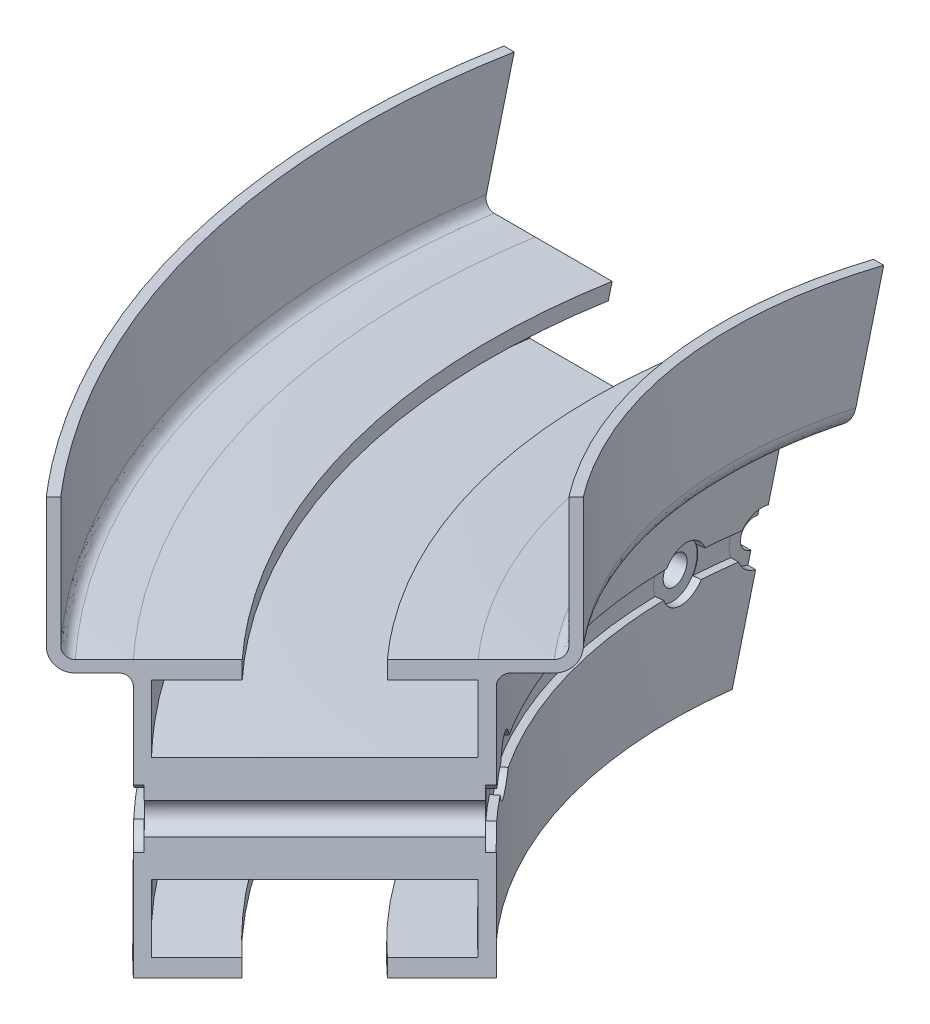
from build123d import *

# Parameters (mm, degrees)
SWEEP1_PITCH                                         = 120
SWEEP1_HEIGHT                                        = 15
SWEEP1_RADIUS                                        = 75
SWEEP1_START_ANGLE                                   = -90
FORO_LAMATO_PER_BULLONE_M5_A_TESTA_ESAGO_D           = 5.4
FORO_LAMATO_PER_BULLONE_M5_A_TESTA_ESAGO_DEPTH       = 60
FORO_LAMATO_PER_BULLONE_M5_A_TESTA_ESAGO_CBORE_D     = 10
FORO_LAMATO_PER_BULLONE_M5_A_TESTA_ESAGO_CBORE_DEPTH = 1.5
FORO_LAMATO_PER_BULLONE_M5_A_TESTA_ESAGO_TIP         = 1.622323671
FORO_LAMATO_PER_BULLONE_M5_A_TESTA_E_2_D             = 5.4
FORO_LAMATO_PER_BULLONE_M5_A_TESTA_E_2_DEPTH         = 60
FORO_LAMATO_PER_BULLONE_M5_A_TESTA_E_2_CBORE_D       = 10
FORO_LAMATO_PER_BULLONE_M5_A_TESTA_E_2_CBORE_DEPTH   = 1.5
FORO_LAMATO_PER_BULLONE_M5_A_TESTA_E_2_TIP           = 1.622323671
TAGLIA_SWEEP1_PITCH                                  = 120
TAGLIA_SWEEP1_HEIGHT                                 = 15
TAGLIA_SWEEP1_RADIUS                                 = 75
TAGLIA_SWEEP1_START_ANGLE                            = -90
SCHIZZO6_W                                           = 1.549169198
SCHIZZO6_H                                           = 5


with BuildPart() as part:
    # Sweep1: sweep along a helix
    with BuildLine() as sweep1_path:
        add(Helix(SWEEP1_PITCH, SWEEP1_HEIGHT, SWEEP1_RADIUS, center=(0, 0, 0), direction=(0, 1, 0), mode=Mode.PRIVATE).rotate(Axis((0, 0, 0), (0, 1, 0)), SWEEP1_START_ANGLE))
    # Schizzo2 → Sweep1 (sweep)
    with BuildSketch(Plane(origin=(-75, 0, 0), x_dir=(1, 0, 0), z_dir=(1.0975449818625416e-14, 0.24677252372232875, 0.9690734345423534))):
        with BuildLine():
            Line((-65, -23.5), (-50, -23.5))
            Line((-50, -23.5), (-50, 19.5))
            ThreePointArc((-50, 19.5), (-49.414213562, 20.914213562), (-48, 21.5))
            Line((-48, 21.5), (-42, 21.5))
            ThreePointArc((-42, 21.5), (-39.171572875, 22.671572875), (-38, 25.5))
            Line((-38, 25.5), (-38, 47.5))
            Line((-38, 47.5), (-40, 47.5))
            Line((-40, 47.5), (-40, 25.5))
            ThreePointArc((-40, 25.5), (-40.585786438, 24.085786438), (-42, 23.5))
            Line((-42, 23.5), (-52.5, 23.5))
            Line((-52.5, 23.5), (-65, 23.5))
            Line((-65, 23.5), (-65, 20.5))
            Line((-65, 20.5), (-52.5, 20.5))
            Line((-52.5, 20.5), (-52.5, 9))
            Line((-52.5, 9), (-97.5, 9))
            Line((-97.5, 9), (-97.5, 20.5))
            Line((-97.5, 20.5), (-85, 20.5))
            Line((-85, 20.5), (-85, 23.5))
            Line((-85, 23.5), (-100, 23.5))
            Line((-100, 23.5), (-108, 23.5))
            ThreePointArc((-108, 23.5), (-109.414213562, 24.085786438), (-110, 25.5))
            Line((-110, 25.5), (-110, 47.5))
            Line((-110, 47.5), (-112, 47.5))
            Line((-112, 47.5), (-112, 25.5))
            ThreePointArc((-112, 25.5), (-110.828427125, 22.671572875), (-108, 21.5))
            Line((-108, 21.5), (-102, 21.5))
            ThreePointArc((-102, 21.5), (-100.585786438, 20.914213562), (-100, 19.5))
            Line((-100, 19.5), (-100, -23.5))
            Line((-100, -23.5), (-85, -23.5))
            Line((-85, -23.5), (-85, -20.5))
            Line((-85, -20.5), (-97.5, -20.5))
            Line((-97.5, -20.5), (-97.5, -9))
            Line((-97.5, -9), (-52.5, -9))
            Line((-52.5, -9), (-52.5, -20.5))
            Line((-52.5, -20.5), (-65, -20.5))
            Line((-65, -20.5), (-65, -23.5))
        make_face()
    sweep(path=sweep1_path.line, is_frenet=True)

    # Foro lamato per Bullone M5 a testa esagonale-1
    with Locations(Plane(origin=(-99.169167537, 12.500016005, 76.095178626), x_dir=(0.608761383675, 0, 0.793353375077), z_dir=(0.793353375077, -3.73878e-07, -0.608761383675))):
        with Locations((0, 0)):
            CounterBoreHole(FORO_LAMATO_PER_BULLONE_M5_A_TESTA_ESAGO_D / 2, FORO_LAMATO_PER_BULLONE_M5_A_TESTA_ESAGO_CBORE_D / 2, FORO_LAMATO_PER_BULLONE_M5_A_TESTA_ESAGO_CBORE_DEPTH, depth=FORO_LAMATO_PER_BULLONE_M5_A_TESTA_ESAGO_DEPTH)
            with Locations((0, 0, -(FORO_LAMATO_PER_BULLONE_M5_A_TESTA_ESAGO_DEPTH + FORO_LAMATO_PER_BULLONE_M5_A_TESTA_ESAGO_TIP / 2))):  # 118° drill point
                Cone(0, FORO_LAMATO_PER_BULLONE_M5_A_TESTA_ESAGO_D / 2, FORO_LAMATO_PER_BULLONE_M5_A_TESTA_ESAGO_TIP, mode=Mode.SUBTRACT)

    # Foro lamato per Bullone M5 a testa e 2
    with Locations(Plane(origin=(-123.930607672, 2.499983995, 16.315774028), x_dir=(0.130525985335, 0, 0.991444888611), z_dir=(0.991444888611, 0, -0.130525985335))):
        with Locations((0, 0)):
            CounterBoreHole(FORO_LAMATO_PER_BULLONE_M5_A_TESTA_E_2_D / 2, FORO_LAMATO_PER_BULLONE_M5_A_TESTA_E_2_CBORE_D / 2, FORO_LAMATO_PER_BULLONE_M5_A_TESTA_E_2_CBORE_DEPTH, depth=FORO_LAMATO_PER_BULLONE_M5_A_TESTA_E_2_DEPTH)
            with Locations((0, 0, -(FORO_LAMATO_PER_BULLONE_M5_A_TESTA_E_2_DEPTH + FORO_LAMATO_PER_BULLONE_M5_A_TESTA_E_2_TIP / 2))):  # 118° drill point
                Cone(0, FORO_LAMATO_PER_BULLONE_M5_A_TESTA_E_2_D / 2, FORO_LAMATO_PER_BULLONE_M5_A_TESTA_E_2_TIP, mode=Mode.SUBTRACT)

    # Schizzo4 → Taglia-Rivoluzione1 (revolve, cut)
    with BuildSketch(Plane(origin=(0, 0, 0), x_dir=(-1, 0, 0), z_dir=(-1.005754594412352e-14, -0.246772523722326, -0.969073434542354))):
        Polygon((126.5, 2.7), (173.5, 2.7), (173.5, 5), (175, 5), (176.5, 5), (176.5, 0), (175, 0), (125, 0), (123.5, 0), (123.5, 5), (125, 5), (126.5, 5), align=None)
    revolve(axis=Axis((-125, 0, 0), (1, 0, 0)), mode=Mode.SUBTRACT)

    # Schizzo5 → Taglia-Rivoluzione2 (revolve, cut)
    with BuildSketch(Plane(origin=(2.536470129, 0.913450177, 2.536470129), x_dir=(0.6796675342580422, 0.12143336169210667, -0.723398909000938), z_dir=(0.6852383970326423, 0.2467725237223261, 0.6852383970326306))):
        Polygon((-171.172570308, 41.3111418), (-169.684393613, 41.123178705), (-169.972603693, 38.841307773), (-123.343067258, 32.951797447), (-123.054857178, 35.233668379), (-121.566680483, 35.045705283), (-120.078503789, 34.857742187), (-120.70504744, 29.897153205), (-122.193224135, 30.085116301), (-171.799113959, 36.350552818), (-173.287290654, 36.538515913), (-172.660747002, 41.499104896), align=None)
    revolve(axis=Axis((-88.388347648, 15, 88.388347648), (-0.7071067811865415, 0, 0.7071067811865537)), mode=Mode.SUBTRACT)

    # Taglia-Sweep1: sweep along a helix
    with BuildLine() as taglia_sweep1_path:
        add(Helix(TAGLIA_SWEEP1_PITCH, TAGLIA_SWEEP1_HEIGHT, TAGLIA_SWEEP1_RADIUS, center=(0, 0, 0), direction=(0, 1, 0), mode=Mode.PRIVATE).rotate(Axis((0, 0, 0), (0, 1, 0)), TAGLIA_SWEEP1_START_ANGLE))
    # Schizzo6 → Taglia-Sweep1 (sweep, cut)
    with BuildSketch(Plane(origin=(-75, 0, 0), x_dir=(1, 0, 0), z_dir=(1.0975449818625416e-14, 0.24677252372232875, 0.9690734345423534))):
        Polygon((-51.5, -2.5), (-49.908355055, -2.5), (-49.950830802, 2.5), (-51.5, 2.5), align=None)
        with Locations((-99.274584599, 0)):
            Rectangle(SCHIZZO6_W, SCHIZZO6_H)
    sweep(path=taglia_sweep1_path.line, is_frenet=True, mode=Mode.SUBTRACT)


solid = part.part
